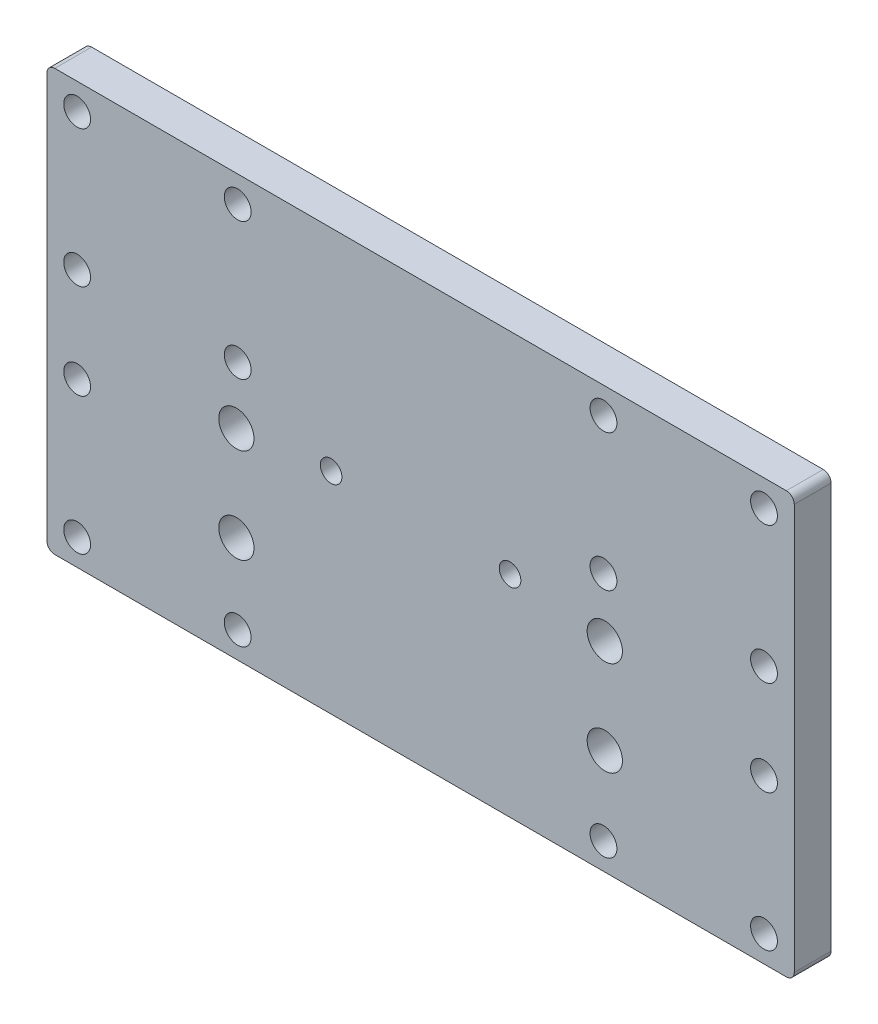
from build123d import *

# Parameters (mm, degrees)
SKETCH1_W           = 142
SKETCH1_H           = 80
BOSS_EXTRUDE1_DEPTH = 3.5
SKETCH2_R           = 2.55
CUT_EXTRUDE1_DEPTH  = 82.792420187
SKETCH3_R           = 2.05
CUT_EXTRUDE2_DEPTH  = 82.792420187
SKETCH4_R           = 3.35
CUT_EXTRUDE3_DEPTH  = 82.792420187
FILLET1_R           = 1.5


with BuildPart() as part:
    # Sketch1 → Boss-Extrude1 (new, symmetric)
    with BuildSketch(Plane.XY):
        Rectangle(SKETCH1_W, SKETCH1_H)
    extrude(amount=BOSS_EXTRUDE1_DEPTH, both=True)

    # Sketch2 → Cut-Extrude1 (cut, through all)
    with BuildSketch(Plane.XY.offset(3.5)):
        with Locations((-65.25, 35)):
            Circle(SKETCH2_R)
        with Locations((-34.75, 35)):
            Circle(SKETCH2_R)
        with Locations((-34.75, 9)):
            Circle(SKETCH2_R)
        with Locations((-65.25, 9)):
            Circle(SKETCH2_R)
        with Locations((65.25, 35)):
            Circle(SKETCH2_R)
        with Locations((65.25, 9)):
            Circle(SKETCH2_R)
        with Locations((34.75, 9)):
            Circle(SKETCH2_R)
        with Locations((34.75, 35)):
            Circle(SKETCH2_R)
        with Locations((-65.25, -9)):
            Circle(SKETCH2_R)
        with Locations((-34.75, -35)):
            Circle(SKETCH2_R)
        with Locations((-65.25, -35)):
            Circle(SKETCH2_R)
        with Locations((65.25, -9)):
            Circle(SKETCH2_R)
        with Locations((65.25, -35)):
            Circle(SKETCH2_R)
        with Locations((34.75, -35)):
            Circle(SKETCH2_R)
    extrude(amount=-CUT_EXTRUDE1_DEPTH, mode=Mode.SUBTRACT)

    # Sketch3 → Cut-Extrude2 (cut, through all)
    with BuildSketch(Plane.XY.offset(3.5)):
        with Locations((-17, 0)):
            Circle(SKETCH3_R)
        with Locations((17, 0)):
            Circle(SKETCH3_R)
    extrude(amount=-CUT_EXTRUDE2_DEPTH, mode=Mode.SUBTRACT)

    # Sketch4 → Cut-Extrude3 (cut, through all)
    with BuildSketch(Plane.XY.offset(3.5)):
        with Locations((-35, -2)):
            Circle(SKETCH4_R)
        with Locations((35, -2)):
            Circle(SKETCH4_R)
        with Locations((35, -20)):
            Circle(SKETCH4_R)
        with Locations((-35, -20)):
            Circle(SKETCH4_R)
    extrude(amount=-CUT_EXTRUDE3_DEPTH, mode=Mode.SUBTRACT)

    # Fillet1
    fillet1_edges = [part.edges().sort_by_distance(p)[0] for p in [
        (-71, -40, 0),
        (71, -40, 0),
        (71, 40, 0),
        (-71, 40, 0),
    ]]
    fillet(fillet1_edges, radius=FILLET1_R)


solid = part.part
